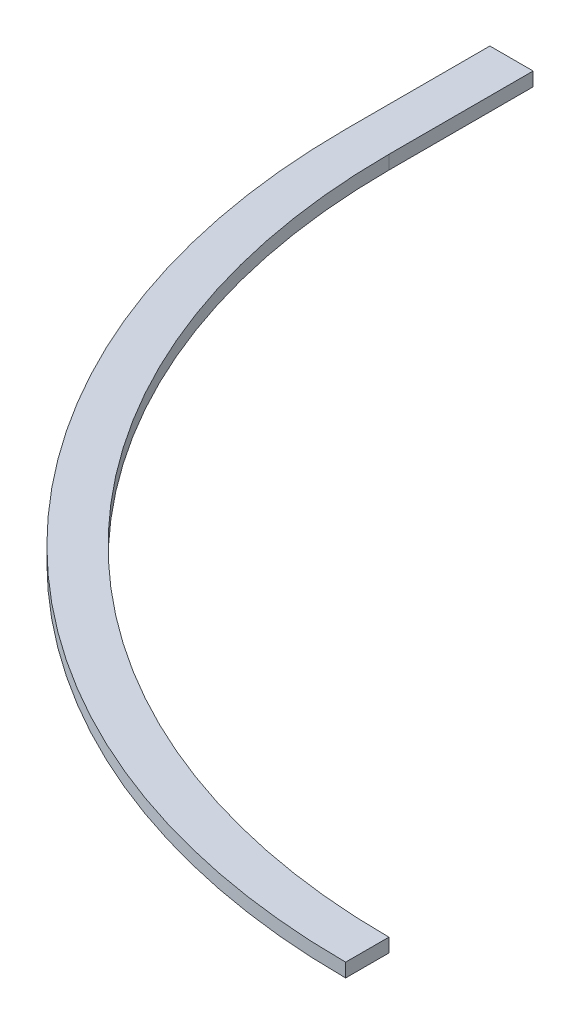
from build123d import *

# Parameters (mm, degrees)
BOSS_EXTRUDE1_DEPTH = 9.525
SKETCH3_W           = 30
SKETCH3_H           = 9.525
BOSS_EXTRUDE2_DEPTH = 100


with BuildPart() as part:
    # Sketch2 → Boss-Extrude1 (new body)
    with BuildSketch(Plane(origin=(0, 0, 0), x_dir=(1, 0, 0), z_dir=(0, 1, 0))):
        with BuildLine():
            ThreePointArc((0, -470), (-332.340187158, -332.340187158), (-470, 0))
            Line((-470, 0), (-500, 0))
            ThreePointArc((-500, 0), (-353.553390593, -353.553390593), (0, -500))
            Line((0, -500), (0, -470))
        make_face()
    extrude(amount=BOSS_EXTRUDE1_DEPTH)

    # Sketch3 → Boss-Extrude2 (add)
    with BuildSketch(Plane(origin=(0, 0, 0), x_dir=(-1, 0, 0), z_dir=(0, 0, -1))):
        with Locations((485, 4.7625)):
            Rectangle(SKETCH3_W, SKETCH3_H)
    extrude(amount=BOSS_EXTRUDE2_DEPTH)


solid = part.part
